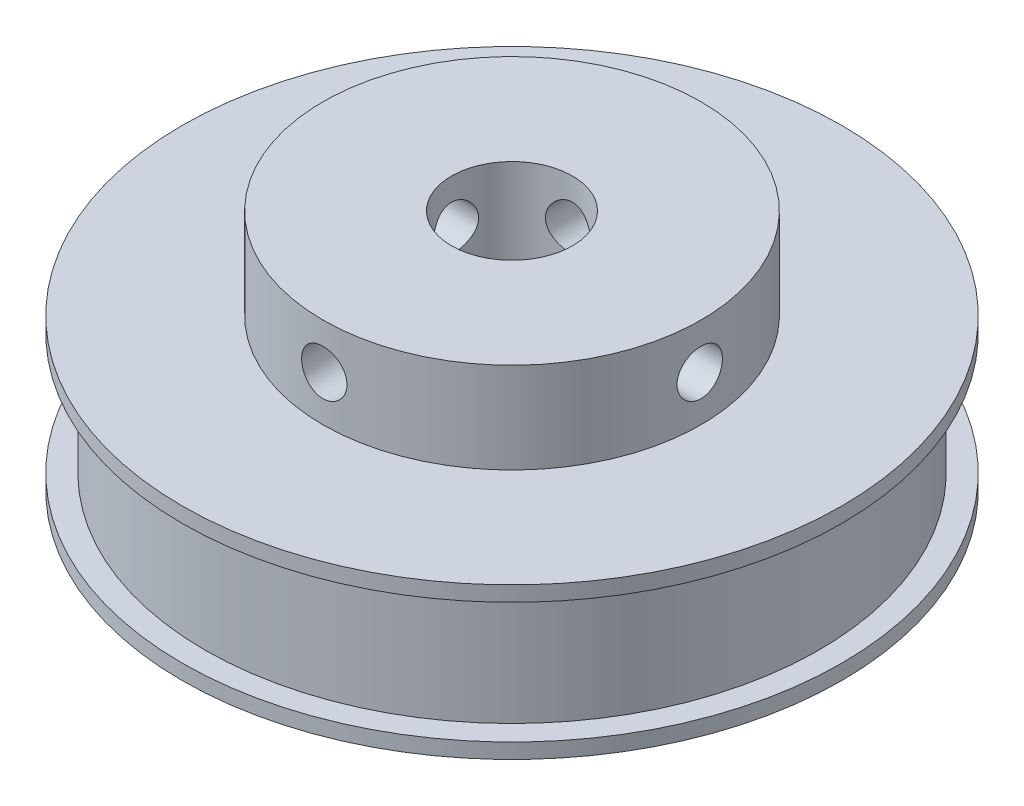
from build123d import *

# Parameters (mm, degrees)
SKETCH_2_R               = 21.8
EXTRUDE_1_DEPTH          = 16
SKETCH_3_R               = 4
CUT_EXTRUDE_1_DEPTH      = 35.734420968
SKETCH_4_OUTSIDE_W       = 58.34
SKETCH_4_OUTSIDE_H       = 58.34
SKETCH_4_OUTSIDE_R       = 12.5
CUT_EXTRUDE_2_DEPTH      = 6
SKETCH_5_OUTSIDE_W       = 58.34
SKETCH_5_OUTSIDE_H       = 58.34
SKETCH_5_OUTSIDE_R       = 20.3
CUT_EXTRUDE_3_DEPTH      = 8
CUT_EXTRUDE_4_DEPTH      = 35.734420968
CUT_EXTRUDE_4_DEPTH_BACK = 35.734420968
SKETCH_6_R               = 1.5
CUT_EXTRUDE_5_DEPTH      = 35.734421014
CUT_EXTRUDE_5_DEPTH_BACK = 35.734421014
SKETCH_7_R               = 1.5


with BuildPart() as part:
    # 草图2 → 凸台-拉伸1 (new body)
    with BuildSketch(Plane(origin=(0, 0, 0), x_dir=(1, 0, 0), z_dir=(0, 1, 0))):
        Circle(SKETCH_2_R)
    extrude(amount=EXTRUDE_1_DEPTH)

    # 草图3 → 切除-拉伸1 (cut, through all)
    with BuildSketch(Plane(origin=(0, 16, 0), x_dir=(1, 0, 0), z_dir=(0, 1, 0))):
        Circle(SKETCH_3_R)
    extrude(amount=-CUT_EXTRUDE_1_DEPTH, mode=Mode.SUBTRACT)

    # 草图4 outside → 切除-拉伸2 (cut)
    with BuildSketch(Plane(origin=(0, 16, 0), x_dir=(1, 0, 0), z_dir=(0, 1, 0))):
        Rectangle(SKETCH_4_OUTSIDE_W, SKETCH_4_OUTSIDE_H)
        Circle(SKETCH_4_OUTSIDE_R, mode=Mode.SUBTRACT)
    extrude(amount=-CUT_EXTRUDE_2_DEPTH, mode=Mode.SUBTRACT)

    # 草图5 outside → 切除-拉伸3 (cut)
    with BuildSketch(Plane(origin=(0, 1, 0), x_dir=(1, 0, 0), z_dir=(0, 1, 0))):
        Rectangle(SKETCH_5_OUTSIDE_W, SKETCH_5_OUTSIDE_H)
        Circle(SKETCH_5_OUTSIDE_R, mode=Mode.SUBTRACT)
    extrude(amount=CUT_EXTRUDE_3_DEPTH, mode=Mode.SUBTRACT)

    # 草图6 → 切除-拉伸4 (cut, two sides: drawn at the far end of the back side and taken through both)
    with BuildSketch(Plane(origin=(0, 0, 0), x_dir=(0, 0, -1), z_dir=(1, 0, 0)).offset(-CUT_EXTRUDE_4_DEPTH_BACK)):
        with Locations((0, 13)):
            Circle(SKETCH_6_R)
    extrude(amount=CUT_EXTRUDE_4_DEPTH + CUT_EXTRUDE_4_DEPTH_BACK, mode=Mode.SUBTRACT)

    # 草图7 → 切除-拉伸5 (cut, two sides: drawn at the far end of the back side and taken through both)
    with BuildSketch(Plane.XY.offset(-CUT_EXTRUDE_5_DEPTH_BACK)):
        with Locations((0, 13)):
            Circle(SKETCH_7_R)
    extrude(amount=CUT_EXTRUDE_5_DEPTH + CUT_EXTRUDE_5_DEPTH_BACK, mode=Mode.SUBTRACT)


solid = part.part
